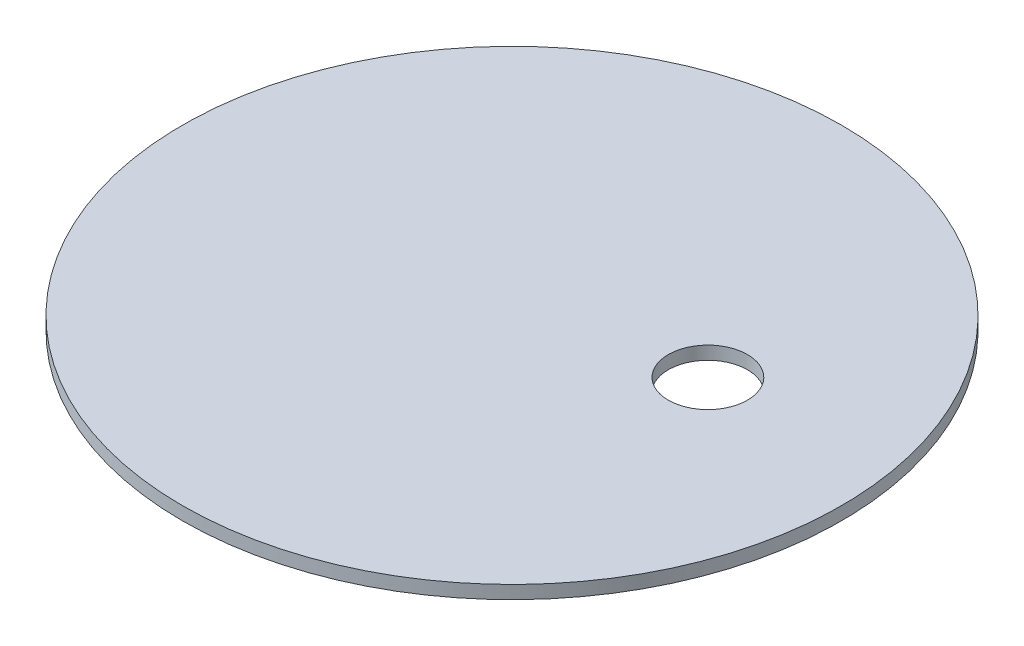
from build123d import *

# Parameters (mm, degrees)
SKETCH13_R          = 50
BOSS_EXTRUDE6_DEPTH = 2
SKETCH15_R          = 6
CUT_EXTRUDE5_DEPTH  = 93.466630636


with BuildPart() as part:
    # Sketch13 → Boss-Extrude6 (new body)
    with BuildSketch(Plane(origin=(0, 0, 0), x_dir=(1, 0, 0), z_dir=(0, 1, 0))):
        with Locations((-23, -6.719289322)):
            Circle(SKETCH13_R)
    extrude(amount=BOSS_EXTRUDE6_DEPTH)

    # Sketch15 → Cut-Extrude5 (cut, through all)
    with BuildSketch(Plane(origin=(0, 2, 0), x_dir=(1, 0, 0), z_dir=(0, 1, 0))):
        Circle(SKETCH15_R)
    extrude(amount=-CUT_EXTRUDE5_DEPTH, mode=Mode.SUBTRACT)


solid = part.part
